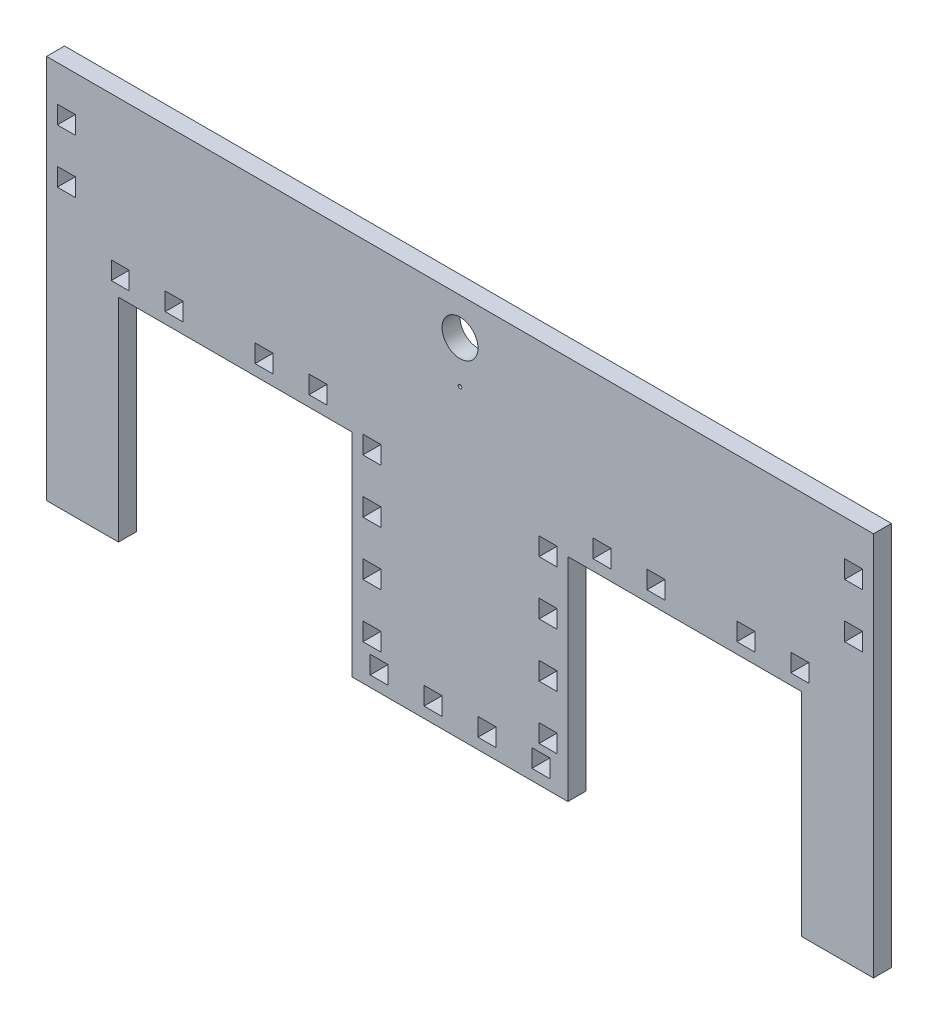
from build123d import *

# Parameters (mm, degrees)
ESQUISSE1_R        = 5
ESQUISSE1_R_2      = 0.5
ESQUISSE1_W        = 5
ESQUISSE1_H        = 5
BOSS_EXTRU_1_DEPTH = 5


with BuildPart() as part:
    # Esquisse1 → Boss.-Extru.1 (new body)
    with BuildSketch(Plane.XY):
        Polygon((-115, 48), (115, 48), (115, 0), (115, -59), (95, -59), (95, 0), (30, 0), (30, -59), (-30, -59), (-30, 0), (-95, 0), (-95, -59), (-115, -59), (-115, 0), align=None)
        with Locations((0, 37.7)):
            Circle(ESQUISSE1_R, mode=Mode.SUBTRACT)
        with Locations((0, 25.95)):
            Circle(ESQUISSE1_R_2, mode=Mode.SUBTRACT)
        with Locations((109.5, 20.5)):
            Rectangle(ESQUISSE1_W, ESQUISSE1_H, mode=Mode.SUBTRACT)
        with Locations((109.5, 35.5)):
            Rectangle(ESQUISSE1_W, ESQUISSE1_H, mode=Mode.SUBTRACT)
        with Locations((24.5, -46.5)):
            Rectangle(ESQUISSE1_W, ESQUISSE1_H, mode=Mode.SUBTRACT)
        with Locations((24.5, -31.5)):
            Rectangle(ESQUISSE1_W, ESQUISSE1_H, mode=Mode.SUBTRACT)
        with Locations((24.5, -16.5)):
            Rectangle(ESQUISSE1_W, ESQUISSE1_H, mode=Mode.SUBTRACT)
        with Locations((24.5, -1.5)):
            Rectangle(ESQUISSE1_W, ESQUISSE1_H, mode=Mode.SUBTRACT)
        with Locations((79.5, 5.5)):
            Rectangle(ESQUISSE1_W, ESQUISSE1_H, mode=Mode.SUBTRACT)
        with Locations((94.5, 5.5)):
            Rectangle(ESQUISSE1_W, ESQUISSE1_H, mode=Mode.SUBTRACT)
        with Locations((39.5, 5.5)):
            Rectangle(ESQUISSE1_W, ESQUISSE1_H, mode=Mode.SUBTRACT)
        with Locations((54.5, 5.5)):
            Rectangle(ESQUISSE1_W, ESQUISSE1_H, mode=Mode.SUBTRACT)
        with Locations((-79.5, 5.5)):
            Rectangle(ESQUISSE1_W, ESQUISSE1_H, mode=Mode.SUBTRACT)
        with Locations((-94.5, 5.5)):
            Rectangle(ESQUISSE1_W, ESQUISSE1_H, mode=Mode.SUBTRACT)
        with Locations((-24.5, -16.5)):
            Rectangle(ESQUISSE1_W, ESQUISSE1_H, mode=Mode.SUBTRACT)
        with Locations((-24.5, -1.5)):
            Rectangle(ESQUISSE1_W, ESQUISSE1_H, mode=Mode.SUBTRACT)
        with Locations((-24.5, -46.5)):
            Rectangle(ESQUISSE1_W, ESQUISSE1_H, mode=Mode.SUBTRACT)
        with Locations((-24.5, -31.5)):
            Rectangle(ESQUISSE1_W, ESQUISSE1_H, mode=Mode.SUBTRACT)
        with Locations((-39.5, 5.5)):
            Rectangle(ESQUISSE1_W, ESQUISSE1_H, mode=Mode.SUBTRACT)
        with Locations((-54.5, 5.5)):
            Rectangle(ESQUISSE1_W, ESQUISSE1_H, mode=Mode.SUBTRACT)
        with Locations((-109.5, 20.5)):
            Rectangle(ESQUISSE1_W, ESQUISSE1_H, mode=Mode.SUBTRACT)
        with Locations((-109.5, 35.5)):
            Rectangle(ESQUISSE1_W, ESQUISSE1_H, mode=Mode.SUBTRACT)
        with Locations((-22.5, -53.5)):
            Rectangle(ESQUISSE1_W, ESQUISSE1_H, mode=Mode.SUBTRACT)
        with Locations((-7.5, -53.5)):
            Rectangle(ESQUISSE1_W, ESQUISSE1_H, mode=Mode.SUBTRACT)
        with Locations((22.5, -53.5)):
            Rectangle(ESQUISSE1_W, ESQUISSE1_H, mode=Mode.SUBTRACT)
        with Locations((7.5, -53.5)):
            Rectangle(ESQUISSE1_W, ESQUISSE1_H, mode=Mode.SUBTRACT)
    extrude(amount=BOSS_EXTRU_1_DEPTH)


solid = part.part
